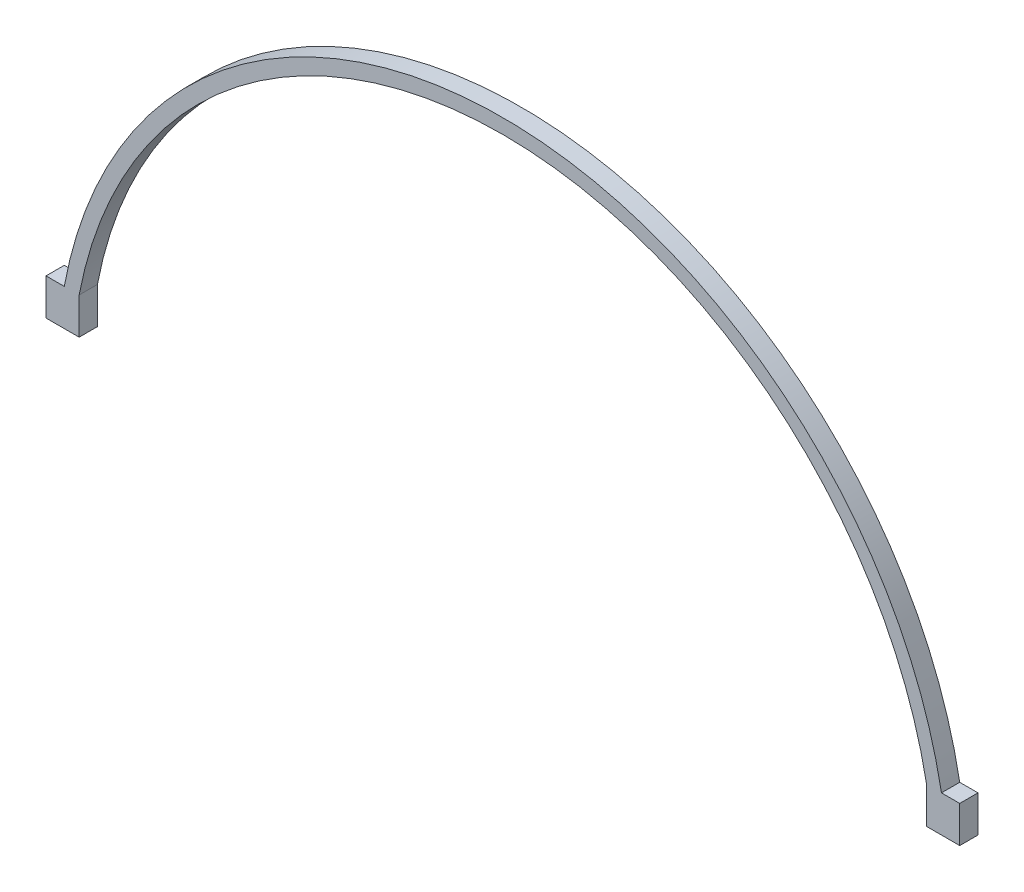
from build123d import *

# Parameters (mm, degrees)
BOSS_EXTRUDE1_DEPTH = 3.175
SKETCH2_W           = 5.758806129
SKETCH2_H           = 3.175
BOSS_EXTRUDE2_DEPTH = 6.35


with BuildPart() as part:
    # Sketch1 → Boss-Extrude1 (new body)
    with BuildSketch(Plane.XY):
        with BuildLine():
            Line((-76.2, 0), (-73.616193871, 0))
            ThreePointArc((-73.616193871, 0), (0, 60.96), (73.616193871, 0))
            Line((73.616193871, 0), (76.2, 0))
            ThreePointArc((76.2, 0), (0, 63.5), (-76.2, 0))
        make_face()
    extrude(amount=BOSS_EXTRUDE1_DEPTH)

    # Sketch2 → Boss-Extrude2 (add)
    with BuildSketch(Plane.XZ):
        with Locations((76.495596936, 1.5875)):
            Rectangle(SKETCH2_W, SKETCH2_H)
        with Locations((-76.495596936, 1.5875)):
            Rectangle(SKETCH2_W, SKETCH2_H)
    extrude(amount=BOSS_EXTRUDE2_DEPTH)


solid = part.part
